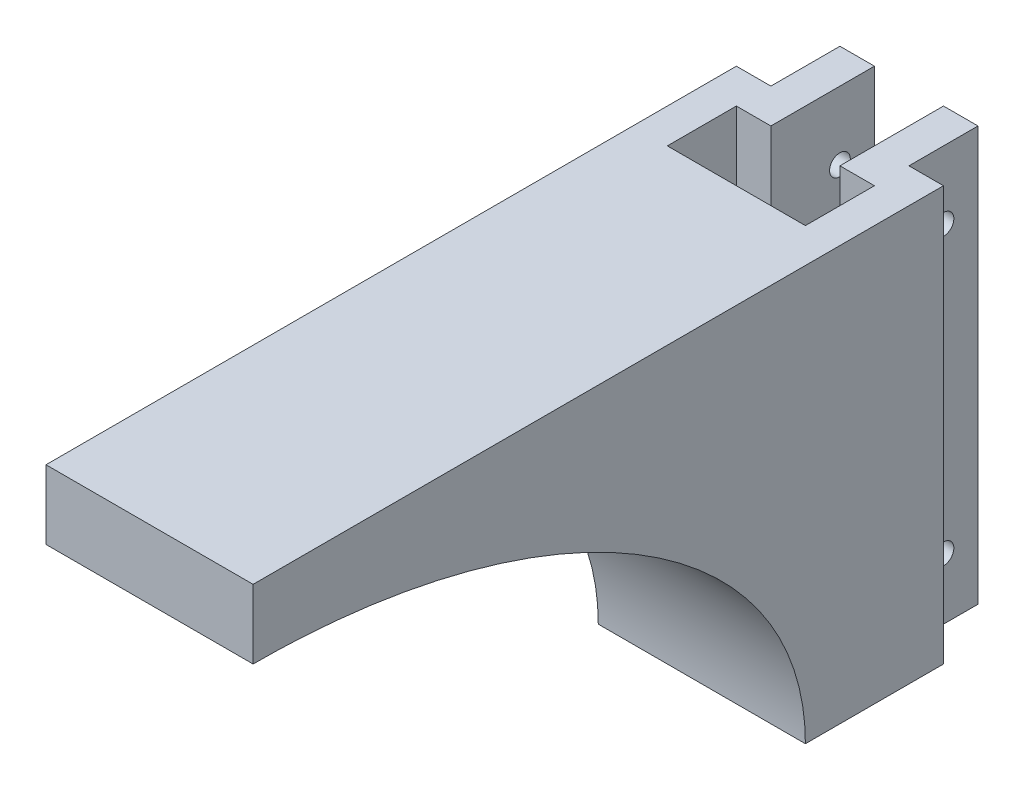
from build123d import *

# Parameters (mm, degrees)
MAKAS_BA_LANT_S_DEPTH    = 60
MOTOR_UZANT_S_DEPTH      = 15
MOTOR_UZANT_S_DEPTH_BACK = 15
IZIM3_R                  = 1.5
C_VATALAR_DEPTH          = 112.018016714


# Read off the part's stored shape, not the designer's step: makas bağlantısı
with BuildPart() as part:
    # makas bağlantısı outline → makas bağlantısı (new body)
    with BuildSketch(Plane(origin=(0, 0, 0), x_dir=(1, 0, 0), z_dir=(0, 1, 0))):
        Polygon((-5, 5), (-5, 20), (-10, 20), (-10, 10), (-15, 10), (-15, -10), (15, -10), (15, 10), (10, 10), (10, 20), (5, 20), (5, 5), (10, 5), (10, -5), (-10, -5), (-10, 5), align=None)
    extrude(amount=MAKAS_BA_LANT_S_DEPTH)

    # Çizim2 → motor uzantısı (add, two sides: drawn at the far end of the back side and taken through both)
    with BuildSketch(Plane(origin=(0, 0, 0), x_dir=(0, 0, -1), z_dir=(1, 0, 0)).offset(-MOTOR_UZANT_S_DEPTH_BACK)):
        with BuildLine():
            Line((-10, 60), (-90, 60))
            Line((-90, 60), (-90, 50))
            add(Edge.make_bspline(
                [(-10, 0), (-10, 50), (-90, 50)],
                knots=[0, 0, 0, 1.570796327, 1.570796327, 1.570796327], degree=2, weights=[1, 0.707106781, 1]))
            Line((-10, 0), (-10, 60))
        make_face()
    extrude(amount=MOTOR_UZANT_S_DEPTH + MOTOR_UZANT_S_DEPTH_BACK)

    # Çizim3 → cıvatalar (cut, through all)
    with BuildSketch(Plane.ZY.offset(10)):
        with Locations((-15, 50.141064744)):
            Circle(IZIM3_R)
        with Locations((-15, 8.810242757)):
            Circle(IZIM3_R)
    extrude(amount=-C_VATALAR_DEPTH, mode=Mode.SUBTRACT)


solid = part.part
